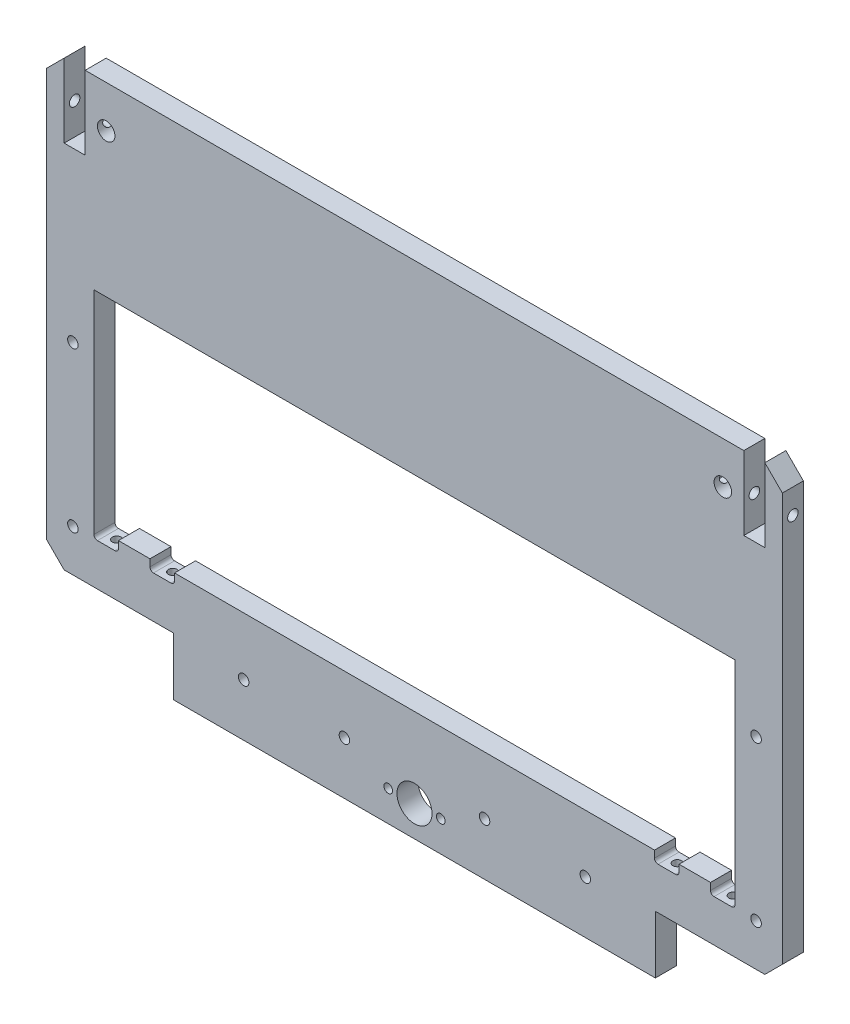
from build123d import *

# Parameters (mm, degrees)
SKETCH1_W                  = 275
SKETCH1_H                  = 33
BOSS_EXTRUDE1_DEPTH        = 12
CUT_EXTRUDE1_REACH         = 141.005
SKETCH2_R                  = 10
SKETCH2_R_2                = 2.5
SKETCH3_W                  = 366
SKETCH3_H                  = 117
BOSS_EXTRUDE2_DEPTH        = 12
CUT_EXTRUDE2_REACH         = 308.55
SKETCH4_R                  = 2.5
CUT_EXTRUDE3_REACH         = 343.869
SKETCH5_W                  = 14
SKETCH5_H                  = 6
FILLET1_R                  = 2
FILLET1_OF_MIRROR2_R       = 2
CHAMFER1_SIZE              = 10
CUT_EXTRUDE6_REACH         = 343.869
SKETCH8_W                  = 12
SKETCH8_H                  = 42
CHAMFER2_SIZE              = 10
F_6_0_6_DIAMETER_HOLE1_D   = 6
F_10_0_10_DIAMETER_HOLE1_D = 10
F_6_0_6_DIAMETER_HOLE4_D   = 6


with BuildPart() as part:
    # Sketch1 → Boss-Extrude1 (new body)
    with BuildSketch(Plane.XY):
        Rectangle(SKETCH1_W, SKETCH1_H)
    extrude(amount=BOSS_EXTRUDE1_DEPTH)

    # Sketch2 → Cut-Extrude1 (cut, up to next)
    with BuildSketch(Plane.XY.offset(12), mode=Mode.PRIVATE) as cut_extrude1_sk1:
        with Locations((0, 1)):
            Circle(SKETCH2_R)
    cut_extrude1_tool1 = extrude(cut_extrude1_sk1.sketch, amount=-CUT_EXTRUDE1_REACH, mode=Mode.PRIVATE) & part.part
    # Sketch2 → Cut-Extrude1 (cut, up to next)
    with BuildSketch(Plane.XY.offset(12), mode=Mode.PRIVATE) as cut_extrude1_sk2:
        with Locations((-15, 1)):
            Circle(SKETCH2_R_2)
    cut_extrude1_tool2 = extrude(cut_extrude1_sk2.sketch, amount=-CUT_EXTRUDE1_REACH, mode=Mode.PRIVATE) & part.part
    # Sketch2 → Cut-Extrude1 (cut, up to next)
    with BuildSketch(Plane.XY.offset(12), mode=Mode.PRIVATE) as cut_extrude1_sk3:
        with Locations((15, 1)):
            Circle(SKETCH2_R_2)
    cut_extrude1_tool3 = extrude(cut_extrude1_sk3.sketch, amount=-CUT_EXTRUDE1_REACH, mode=Mode.PRIVATE) & part.part
    add(cut_extrude1_tool1.solids().sort_by_distance((0, 1, 12))[0], mode=Mode.SUBTRACT)
    add(cut_extrude1_tool2.solids().sort_by_distance((-15, 1, 12))[0], mode=Mode.SUBTRACT)
    add(cut_extrude1_tool3.solids().sort_by_distance((15, 1, 12))[0], mode=Mode.SUBTRACT)

    # Sketch3 → Boss-Extrude2 (add)
    with BuildSketch(Plane.XY.offset(12)):
        Polygon((-210, 16.5), (210, 16.5), (210, 46.5), (210, 269.5), (-210, 269.5), (-210, 46.5), align=None)
        with Locations((0, 105)):
            Rectangle(SKETCH3_W, SKETCH3_H, mode=Mode.SUBTRACT)
    extrude(amount=-BOSS_EXTRUDE2_DEPTH)

    # Sketch4 → Cut-Extrude2 (cut, up to next)
    with BuildSketch(Plane(origin=(0, 46.5, 0), x_dir=(1, 0, 0), z_dir=(0, 1, 0)), mode=Mode.PRIVATE) as cut_extrude2_sk1:
        with Locations(Location((-144, -6, 0), (0, 0, 270))):
            Circle(SKETCH4_R)
    cut_extrude2_tool1 = extrude(cut_extrude2_sk1.sketch, amount=-CUT_EXTRUDE2_REACH, mode=Mode.PRIVATE) & part.part
    # Sketch4 → Cut-Extrude2 (cut, up to next)
    with BuildSketch(Plane(origin=(0, 46.5, 0), x_dir=(1, 0, 0), z_dir=(0, 1, 0)), mode=Mode.PRIVATE) as cut_extrude2_sk2:
        with Locations(Location((-176, -6, 0), (0, 0, 270))):
            Circle(SKETCH4_R)
    cut_extrude2_tool2 = extrude(cut_extrude2_sk2.sketch, amount=-CUT_EXTRUDE2_REACH, mode=Mode.PRIVATE) & part.part
    cut_extrude2_1 = cut_extrude2_tool1.solids().sort_by_distance((-144, 46.5, 6))[0]
    add(cut_extrude2_1, mode=Mode.SUBTRACT)
    cut_extrude2_2 = cut_extrude2_tool2.solids().sort_by_distance((-176, 46.5, 6))[0]
    add(cut_extrude2_2, mode=Mode.SUBTRACT)
    cut_extrude2 = cut_extrude2_1 + cut_extrude2_2  # Cut-Extrude2 as one shape, for the pattern or mirror that repeats it

    # Mirror1: Cut-Extrude2 across plane
    add(cut_extrude2.mirror(Plane(origin=(0, 0, 0), x_dir=(0, 0, 1), z_dir=(1, 0, 0))), mode=Mode.SUBTRACT)

    # Sketch5 → Cut-Extrude3 (cut, up to next)
    with BuildSketch(Plane.XY.offset(12), mode=Mode.PRIVATE) as cut_extrude3_sk1:
        with Locations((-176, 43.5)):
            Rectangle(SKETCH5_W, SKETCH5_H)
    cut_extrude3_tool1 = extrude(cut_extrude3_sk1.sketch, amount=-CUT_EXTRUDE3_REACH, mode=Mode.PRIVATE) & part.part
    # Sketch5 → Cut-Extrude3 (cut, up to next)
    with BuildSketch(Plane.XY.offset(12), mode=Mode.PRIVATE) as cut_extrude3_sk2:
        with Locations((-144, 43.5)):
            Rectangle(SKETCH5_W, SKETCH5_H)
    cut_extrude3_tool2 = extrude(cut_extrude3_sk2.sketch, amount=-CUT_EXTRUDE3_REACH, mode=Mode.PRIVATE) & part.part
    cut_extrude3_1 = cut_extrude3_tool1.solids().sort_by_distance((-176, 43.5, 12))[0]
    add(cut_extrude3_1, mode=Mode.SUBTRACT)
    cut_extrude3_2 = cut_extrude3_tool2.solids().sort_by_distance((-144, 43.5, 12))[0]
    add(cut_extrude3_2, mode=Mode.SUBTRACT)
    cut_extrude3 = cut_extrude3_1 + cut_extrude3_2  # Cut-Extrude3 as one shape, for the pattern or mirror that repeats it

    # Fillet1
    fillet1_edges = [part.edges().sort_by_distance(p)[0] for p in [
        (-169, 40.5, 6),
        (-183, 40.5, 6),
        (-137, 40.5, 6),
        (-151, 40.5, 6),
    ]]
    fillet(fillet1_edges, radius=FILLET1_R)

    # Mirror2: Cut-Extrude3 across plane
    add(cut_extrude3.mirror(Plane(origin=(0, 0, 0), x_dir=(0, 0, 1), z_dir=(1, 0, 0))), mode=Mode.SUBTRACT)

    # Fillet1 of Mirror2
    fillet1_of_mirror2_edges = [part.edges().sort_by_distance(p)[0] for p in [
        (169, 40.5, 6),
        (183, 40.5, 6),
        (137, 40.5, 6),
        (151, 40.5, 6),
    ]]
    fillet(fillet1_of_mirror2_edges, radius=FILLET1_OF_MIRROR2_R)

    # Chamfer1
    chamfer1_edges = [part.edges().sort_by_distance(p)[0] for p in [
        (210, 16.5, 6),
        (-210, 16.5, 6),
    ]]
    chamfer(chamfer1_edges, length=CHAMFER1_SIZE)

    # Sketch8 → Cut-Extrude6 (cut, up to next)
    with BuildSketch(Plane.XY.offset(12), mode=Mode.PRIVATE) as cut_extrude6_sk1:
        with Locations((-194, 248.5)):
            Rectangle(SKETCH8_W, SKETCH8_H)
    cut_extrude6_tool1 = extrude(cut_extrude6_sk1.sketch, amount=-CUT_EXTRUDE6_REACH, mode=Mode.PRIVATE) & part.part
    # Sketch8 → Cut-Extrude6 (cut, up to next)
    with BuildSketch(Plane.XY.offset(12), mode=Mode.PRIVATE) as cut_extrude6_sk2:
        with Locations((194, 248.5)):
            Rectangle(SKETCH8_W, SKETCH8_H)
    cut_extrude6_tool2 = extrude(cut_extrude6_sk2.sketch, amount=-CUT_EXTRUDE6_REACH, mode=Mode.PRIVATE) & part.part
    add(cut_extrude6_tool1.solids().sort_by_distance((-194, 248.5, 12))[0], mode=Mode.SUBTRACT)
    add(cut_extrude6_tool2.solids().sort_by_distance((194, 248.5, 12))[0], mode=Mode.SUBTRACT)

    # Chamfer2
    chamfer2_edges = [part.edges().sort_by_distance(p)[0] for p in [
        (210, 269.5, 6),
        (-210, 269.5, 6),
    ]]
    chamfer(chamfer2_edges, length=CHAMFER2_SIZE - 0.0001)  # a hair under: the kernel refuses the full size

    # Ø6.0 (6) Diameter Hole1 (through all)
    with Locations(Plane(origin=(0, 0, 0), x_dir=(-1, 0, 0), z_dir=(0, 0, -1))):
        with Locations((195, 131.5), (195, 40.5)):
            f_6_0_6_diameter_hole1 = Hole(F_6_0_6_DIAMETER_HOLE1_D / 2)

    # Ø10.0 (10) Diameter Hole1 (through all)
    with Locations(Plane(origin=(0, 0, 0), x_dir=(-1, 0, 0), z_dir=(0, 0, -1))):
        with Locations((176, 245.5)):
            f_10_0_10_diameter_hole1 = Hole(F_10_0_10_DIAMETER_HOLE1_D / 2)

    # Sketch13 → Ø6.0 (6) Diameter Hole2 (revolve, cut)
    with BuildSketch(Plane(origin=(-188, 245.5, 6), x_dir=(0, 0, 1), z_dir=(0, 1, 0))):
        Polygon((0, 0), (0, 21.802581857), (3, 20), (3, 0), align=None)
    f_6_0_6_diameter_hole2 = revolve(axis=Axis((-194.35, 245.5, 6), (1, 0, 0)), mode=Mode.SUBTRACT)

    # Sketch15 → Ø6.0 (6) Diameter Hole3 (revolve, cut)
    with BuildSketch(Plane(origin=(-210, 245.5, 6), x_dir=(0, 0, 1), z_dir=(0, 1, 0))):
        Polygon((0, 0), (0, 21.802581857), (3, 20), (3, 0), align=None)
    f_6_0_6_diameter_hole3 = revolve(axis=Axis((-216.35, 245.5, 6), (1, 0, 0)), mode=Mode.SUBTRACT)

    # Mirror3: Ø6.0 (6) Diameter Hole1, Ø10.0 (10) Diameter Hole1, Ø6.0 (6) Diameter Hole2, Ø6.0 (6) Diameter Hole3 across plane
    add(f_6_0_6_diameter_hole1.mirror(Plane(origin=(0, 0, 0), x_dir=(0, 0, 1), z_dir=(1, 0, 0))), mode=Mode.SUBTRACT)
    add(f_10_0_10_diameter_hole1.mirror(Plane(origin=(0, 0, 0), x_dir=(0, 0, 1), z_dir=(1, 0, 0))), mode=Mode.SUBTRACT)
    add(f_6_0_6_diameter_hole2.mirror(Plane(origin=(0, 0, 0), x_dir=(0, 0, 1), z_dir=(1, 0, 0))), mode=Mode.SUBTRACT)
    add(f_6_0_6_diameter_hole3.mirror(Plane(origin=(0, 0, 0), x_dir=(0, 0, 1), z_dir=(1, 0, 0))), mode=Mode.SUBTRACT)

    # Ø6.0 (6) Diameter Hole4 (through all)
    with Locations(Plane(origin=(0, 0, 0), x_dir=(-1, 0, 0), z_dir=(0, 0, -1))):
        with Locations((-97.5, 13.5), (-40, 13.5), (40, 13.5), (97.5, 13.5)):
            Hole(F_6_0_6_DIAMETER_HOLE4_D / 2)


solid = part.part
